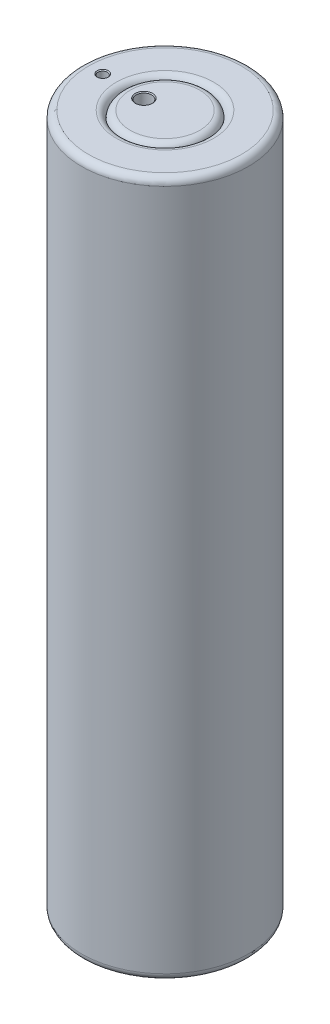
from build123d import *

# Parameters (mm, degrees)
CONG_1_R                                            = 5
CONG_2_R                                            = 5
ESQUISSE3_W                                         = 30
ESQUISSE3_H                                         = 500
ESQUISSE3_W_2                                       = 22
ESQUISSE3_H_2                                       = 480
CONG_3_R                                            = 5
CONG_4_R                                            = 5
PER_AGE_POUR_TUYAU_POUR_TROU_TARAUD_1_4_D           = 11.1252
PER_AGE_POUR_TUYAU_POUR_TROU_TARAUD_1_4_DEPTH       = 10
PER_AGE_POUR_TUYAU_POUR_TROU_TARAUD_1_4_CSINK_D     = 12.3952
PER_AGE_POUR_TUYAU_POUR_TROU_TARAUD_1_4_CSINK_ANGLE = 90
D_GAGEMENT_1_21_D                                   = 13.49248
D_GAGEMENT_1_21_DEPTH                               = 10
D_GAGEMENT_1_21_CSINK_D                             = 14.76248
D_GAGEMENT_1_21_CSINK_ANGLE                         = 90
PER_AGE_POUR_TUYAU_POUR_TROU_TARAUD_2_D             = 11.1252
PER_AGE_POUR_TUYAU_POUR_TROU_TARAUD_2_DEPTH         = 10
PER_AGE_POUR_TUYAU_POUR_TROU_TARAUD_2_CSINK_D       = 12.3952
PER_AGE_POUR_TUYAU_POUR_TROU_TARAUD_2_CSINK_ANGLE   = 90
D_GAGEMENT_1_42_D                                   = 6.7564
D_GAGEMENT_1_42_CSINK_D                             = 8.0264
D_GAGEMENT_1_42_CSINK_ANGLE                         = 90
D_GAGEMENT_1_43_D                                   = 6.7564
D_GAGEMENT_1_43_DEPTH                               = 10
D_GAGEMENT_1_43_CSINK_D                             = 8.0264
D_GAGEMENT_1_43_CSINK_ANGLE                         = 90


with BuildPart() as part:
    # Esquisse2 → Révolution1 (revolve)
    with BuildSketch(Plane(origin=(0, 0, 0), x_dir=(0, 0, -1), z_dir=(1, 0, 0))):
        Polygon((12.834024955, -467.667682927), (12.834024955, -477.667682927), (-17.165975045, -477.667682927), (-17.165975045, 22.332317073), (12.834024955, 22.332317073), (12.834024955, 12.332317073), (-13.165975045, 12.332317073), (-13.165975045, -467.667682927), align=None)
    revolve(axis=Axis((0, -467.667682927, -12.834024955), (0, -1, 0)))

    # Congé1
    cong_1_edges = [part.edges().sort_by_distance(p)[0] for p in [
        (0, 22.332317073, -42.834024955),
    ]]
    fillet(cong_1_edges, radius=CONG_1_R)

    # Congé2
    cong_2_edges = [part.edges().sort_by_distance(p)[0] for p in [
        (0, -477.667682927, -42.834024955),
    ]]
    fillet(cong_2_edges, radius=CONG_2_R)

    # Esquisse3 → Révolution2 (revolve)
    with BuildSketch(Plane(origin=(0, 0, 0), x_dir=(0, 0, -1), z_dir=(1, 0, 0)), mode=Mode.PRIVATE) as r_volution2_sk:
        with Locations((-32.165975045, -227.667682927)):
            Rectangle(ESQUISSE3_W, ESQUISSE3_H)
        with Locations((-32.165975045, -227.667682927)):
            Rectangle(ESQUISSE3_W_2, ESQUISSE3_H_2, mode=Mode.SUBTRACT)
    revolve(r_volution2_sk.sketch.rotate(Axis((0, -472.667682927, -12.834024955), (0, 1, 0)), 180), axis=Axis((0, -472.667682927, -12.834024955), (0, 1, 0)))

    # Congé3
    cong_3_edges = [part.edges().sort_by_distance(p)[0] for p in [
        (0, 22.332317073, 47.165975045),
        (0, 22.332317073, 17.165975045),
    ]]
    fillet(cong_3_edges, radius=CONG_3_R - 0.0001)  # a hair under: the kernel refuses the full size

    # Congé4
    cong_4_edges = [part.edges().sort_by_distance(p)[0] for p in [
        (0, -477.667682927, 17.165975045),
        (0, -477.667682927, 47.165975045),
    ]]
    fillet(cong_4_edges, radius=CONG_4_R - 0.0001)  # a hair under: the kernel refuses the full size

    # Per_age pour tuyau pour trou taraud_ 1_4
    with Locations(Plane(origin=(-14.998951778, 22.332317073, -12.656696011), x_dir=(0, 0, 1), z_dir=(0, 1, 0))):
        with Locations((0, 0)):
            CounterSinkHole(PER_AGE_POUR_TUYAU_POUR_TROU_TARAUD_1_4_D / 2, PER_AGE_POUR_TUYAU_POUR_TROU_TARAUD_1_4_CSINK_D / 2, depth=PER_AGE_POUR_TUYAU_POUR_TROU_TARAUD_1_4_DEPTH, counter_sink_angle=PER_AGE_POUR_TUYAU_POUR_TROU_TARAUD_1_4_CSINK_ANGLE)

    # Dégagement 1/21
    with Locations(Plane(origin=(-44.999519302, -477.667682927, -13.042021564), x_dir=(0, 0, -1), z_dir=(0, -1, 0))):
        with Locations((0, 0)):
            CounterSinkHole(D_GAGEMENT_1_21_D / 2, D_GAGEMENT_1_21_CSINK_D / 2, depth=D_GAGEMENT_1_21_DEPTH, counter_sink_angle=D_GAGEMENT_1_21_CSINK_ANGLE)

    # Per_age pour tuyau pour trou taraud_ 2
    with Locations(Plane(origin=(0, -477.667682927, 0), x_dir=(-1, 0, 0), z_dir=(0, -1, 0))):
        with Locations((14.998451643, 13.049543658)):
            CounterSinkHole(PER_AGE_POUR_TUYAU_POUR_TROU_TARAUD_2_D / 2, PER_AGE_POUR_TUYAU_POUR_TROU_TARAUD_2_CSINK_D / 2, depth=PER_AGE_POUR_TUYAU_POUR_TROU_TARAUD_2_DEPTH, counter_sink_angle=PER_AGE_POUR_TUYAU_POUR_TROU_TARAUD_2_CSINK_ANGLE)

    # Dégagement 1/42 (through all)
    with Locations(Plane(origin=(0, 22.332317073, 0), x_dir=(1, 0, 0), z_dir=(0, 1, 0))):
        with Locations((-44.999519302, 13.042021564)):
            CounterSinkHole(D_GAGEMENT_1_42_D / 2, D_GAGEMENT_1_42_CSINK_D / 2, counter_sink_angle=D_GAGEMENT_1_42_CSINK_ANGLE)

    # Dégagement 1/43
    with Locations(Plane(origin=(0, -477.667682927, 0), x_dir=(-1, 0, 0), z_dir=(0, -1, 0))):
        with Locations((-44.995354929, 12.187468846)):
            CounterSinkHole(D_GAGEMENT_1_43_D / 2, D_GAGEMENT_1_43_CSINK_D / 2, depth=D_GAGEMENT_1_43_DEPTH, counter_sink_angle=D_GAGEMENT_1_43_CSINK_ANGLE)


solid = part.part
